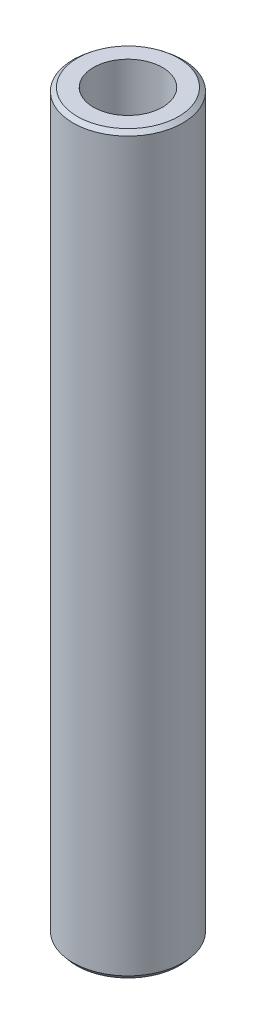
from build123d import *
from OCP.BRepFilletAPI import BRepFilletAPI_MakeChamfer

# Parameters (mm, degrees)
SKETCH1_R           = 35
BOSS_EXTRUDE1_DEPTH = 468.722640157
SKETCH2_R           = 22.003906739
CUT_EXTRUDE1_DEPTH  = 472.32888029
CHAMFER1_SIZE       = 2.217962897
CHAMFER1_SIZE2      = 2.726103529


with BuildPart() as part:
    # Sketch1 → Boss-Extrude1 (new body)
    with BuildSketch(Plane(origin=(0, 0, 0), x_dir=(1, 0, 0), z_dir=(0, 1, 0))):
        Circle(SKETCH1_R)
    extrude(amount=BOSS_EXTRUDE1_DEPTH)

    # Sketch2 → Cut-Extrude1 (cut, through all)
    with BuildSketch(Plane(origin=(0, 0, 0), x_dir=(1, 0, 0), z_dir=(0, 1, 0))):
        Circle(SKETCH2_R)
    extrude(amount=CUT_EXTRUDE1_DEPTH, mode=Mode.SUBTRACT)

    # Chamfer1: one chamfer whose edges measure the first distance from different faces: ONE call of the kernel's chamfer builder (chamfer() names one face for all edges)
    chamfer1_edges_1 = [part.edges().sort_by_distance(p)[0] for p in [
        (-35, 468.722640157, 0),
    ]]
    chamfer1_side_1 = [part.faces().sort_by_distance(p)[0] for p in [
        (-35, 234.361320078, 0),
    ]]
    chamfer1_edges_2 = [part.edges().sort_by_distance(p)[0] for p in [
        (-35, 0, 0),
    ]]
    chamfer1_side_2 = [part.faces().sort_by_distance(p)[0] for p in [
        (-34.010050506, 0, 0),
    ]]
    chamfer1 = BRepFilletAPI_MakeChamfer(part.part.solid().wrapped)
    for e in chamfer1_edges_1:
        chamfer1.Add(CHAMFER1_SIZE, CHAMFER1_SIZE2, e.wrapped, chamfer1_side_1[0].wrapped)  # the first distance lies on this face
    for e in chamfer1_edges_2:
        chamfer1.Add(CHAMFER1_SIZE, CHAMFER1_SIZE2, e.wrapped, chamfer1_side_2[0].wrapped)  # the first distance lies on this face
    add(Compound.cast(chamfer1.Shape()), mode=Mode.REPLACE)


solid = part.part
